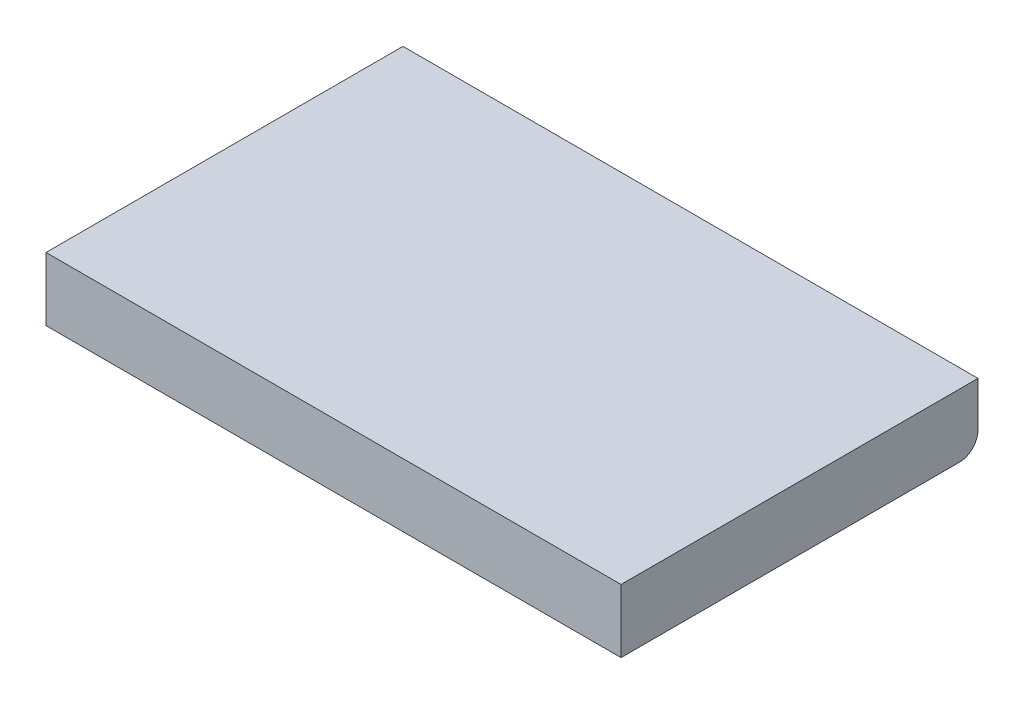
from build123d import *

# Parameters (mm, degrees)
IZIM1_W                     = 158.200000084
IZIM1_H                     = 98.199999942
Y_KSEKLIK_EKSTR_ZYON1_DEPTH = 6.35
Y_KSEKLIK_EKSTR_ZYON2_DEPTH = 34.142000042
Y_KSEKLIK_EKSTR_ZYON3_DEPTH = 34.650000042
IZIM5_R                     = 2.5
KES_EKSTR_ZYON1_DEPTH       = 34.142000042
IZIM6_R                     = 2.500009889
KES_EKSTR_ZYON2_DEPTH       = 34.142000042
IZIM7_W                     = 98.200002037
IZIM7_H                     = 11.08
Y_KSEKLIK_EKSTR_ZYON4_DEPTH = 6.35
IZIM10_W                    = 98.200002037
IZIM10_H                    = 11.08
Y_KSEKLIK_EKSTR_ZYON5_DEPTH = 6.35
IZIM12_W                    = 145.500000084
IZIM12_H                    = 11.08
Y_KSEKLIK_EKSTR_ZYON6_DEPTH = 6.35
RADYUS1_R                   = 5.08
RADYUS2_R                   = 5.08
IZIM15_R                    = 2.500009889
KES_EKSTR_ZYON3_DEPTH       = 6.35


with BuildPart() as part:
    # Çizim1 → Yükseklik-Ekstrüzyon1 (new body)
    with BuildSketch(Plane(origin=(0, 0, 0), x_dir=(1, 0, 0), z_dir=(0, 1, 0))):
        Rectangle(IZIM1_W, IZIM1_H)
    extrude(amount=Y_KSEKLIK_EKSTR_ZYON1_DEPTH)

    # Çizim2 → Yükseklik-Ekstrüzyon2 (add)
    with BuildSketch(Plane(origin=(-47.096000042, 0, 0), x_dir=(0, 0, -1), z_dir=(1, 0, 0))):
        with BuildLine():
            Line((49.100004162, 4.89e-07), (42.750004162, 4.89e-07))
            Line((42.750004162, 4.89e-07), (42.750004162, -2.799659899))
            ThreePointArc((42.750004162, -2.799659899), (45.925004162, -9.728237327), (49.100004162, -2.799659899))
            Line((49.100004162, -2.799659899), (49.100004162, 4.89e-07))
        make_face()
    extrude(amount=Y_KSEKLIK_EKSTR_ZYON2_DEPTH)


with BuildPart() as y_kseklik_ekstr_zyon3_tool:
    # Çizim3 → Yükseklik-Ekstrüzyon3 (new body)
    with BuildSketch(Plane.ZY.offset(-47.096000042)):
        with BuildLine():
            Line((-42.749997505, -7.075e-06), (-49.099997505, -7.075e-06))
            Line((-49.099997505, -7.075e-06), (-49.099997505, -2.799667463))
            ThreePointArc((-49.099997505, -2.799667463), (-45.924997505, -9.728244892), (-42.749997505, -2.799667463))
            Line((-42.749997505, -2.799667463), (-42.749997505, -7.075e-06))
        make_face()
    extrude(amount=Y_KSEKLIK_EKSTR_ZYON3_DEPTH)


with BuildPart() as part_1:
    add(part.part)


with BuildPart() as part_2:
    # Yükseklik-Ekstrüzyon3: joined with y_kseklik_ekstr_zyon3_tool
    add(part_1.part.fuse(y_kseklik_ekstr_zyon3_tool.part, tol=0.00001))

    # Çizim5 → Kes-Ekstrüzyon1 (cut)
    with BuildSketch(Plane(origin=(47.096000042, 0, 0), x_dir=(0, 0, -1), z_dir=(1, 0, 0))):
        with Locations((45.924997505, -5.536489024)):
            Circle(IZIM5_R)
    extrude(amount=-KES_EKSTR_ZYON1_DEPTH, mode=Mode.SUBTRACT)

    # Çizim6 → Kes-Ekstrüzyon2 (cut)
    with BuildSketch(Plane.ZY.offset(47.096000042)):
        with Locations((-45.925004162, -5.536481459)):
            Circle(IZIM6_R)
    extrude(amount=-KES_EKSTR_ZYON2_DEPTH, mode=Mode.SUBTRACT)

    # Çizim7 → Yükseklik-Ekstrüzyon4 (add)
    with BuildSketch(Plane.ZY.offset(79.100000042)):
        with Locations((-1.047e-06, -5.54)):
            Rectangle(IZIM7_W, IZIM7_H)
    extrude(amount=-Y_KSEKLIK_EKSTR_ZYON4_DEPTH)

    # Çizim10 → Yükseklik-Ekstrüzyon5 (add)
    with BuildSketch(Plane(origin=(79.100000042, 0, 0), x_dir=(0, 0, -1), z_dir=(1, 0, 0))):
        with Locations((1.047e-06, -5.54)):
            Rectangle(IZIM10_W, IZIM10_H)
    extrude(amount=-Y_KSEKLIK_EKSTR_ZYON5_DEPTH)

    # Çizim12 → Yükseklik-Ekstrüzyon6 (add)
    with BuildSketch(Plane.XY.offset(49.099999971)):
        with Locations((0, -5.54)):
            Rectangle(IZIM12_W, IZIM12_H)
    extrude(amount=-Y_KSEKLIK_EKSTR_ZYON6_DEPTH)

    # Radyus1
    radyus1_edges = [part_2.edges().sort_by_distance(p)[0] for p in [
        (75.925000042, -11.08, -49.100002066),
    ]]
    fillet(radyus1_edges, radius=RADYUS1_R)

    # Radyus2
    radyus2_edges = [part_2.edges().sort_by_distance(p)[0] for p in [
        (-75.925000042, -11.08, -49.100002066),
    ]]
    fillet(radyus2_edges, radius=RADYUS2_R)

    # Çizim15 → Kes-Ekstrüzyon3 (cut)
    with BuildSketch(Plane.ZY.offset(79.100000042)):
        with Locations((-45.925004162, -5.536481459)):
            Circle(IZIM15_R)
    extrude(amount=-KES_EKSTR_ZYON3_DEPTH, mode=Mode.SUBTRACT)


solid = part_2.part
